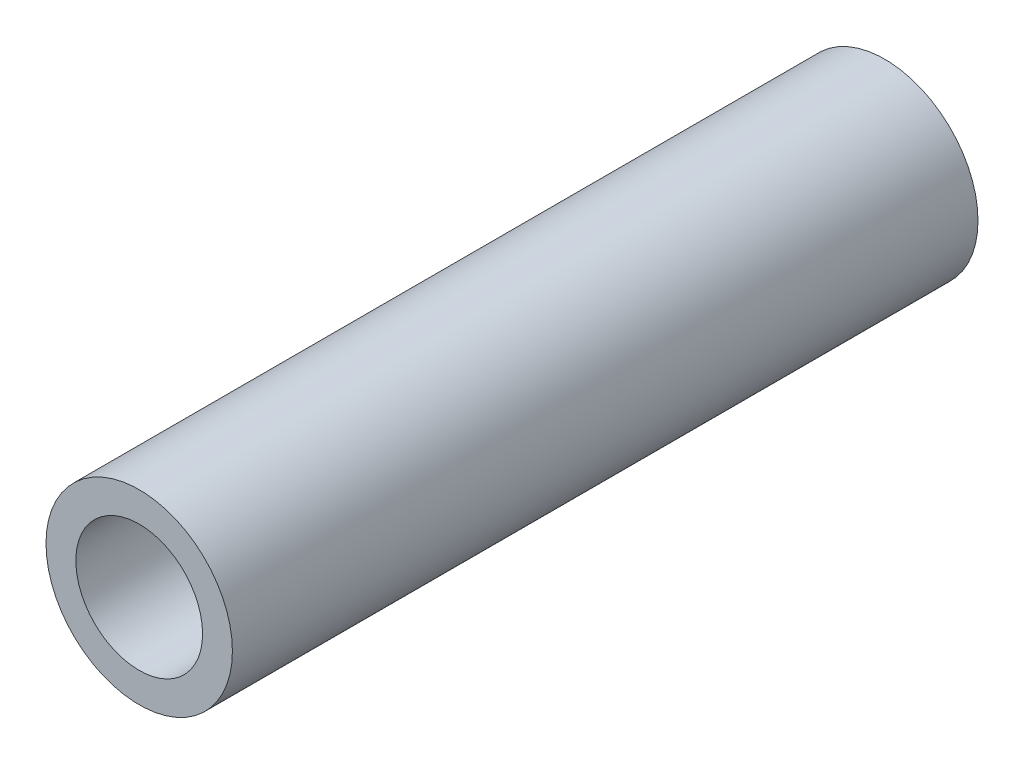
from build123d import *

# Parameters (mm, degrees)
SKETCH1_R            = 2.5
BOSS_EXTRUDE1_DEPTH  = 20
M3_CLEARANCE_HOLE1_D = 3.4


with BuildPart() as part:
    # Sketch1 → Boss-Extrude1 (new body)
    with BuildSketch(Plane.XY):
        Circle(SKETCH1_R)
    extrude(amount=BOSS_EXTRUDE1_DEPTH)

    # M3 Clearance Hole1 (through all)
    with Locations(Plane.XY.offset(20)):
        with Locations((0, 0)):
            Hole(M3_CLEARANCE_HOLE1_D / 2)


solid = part.part
